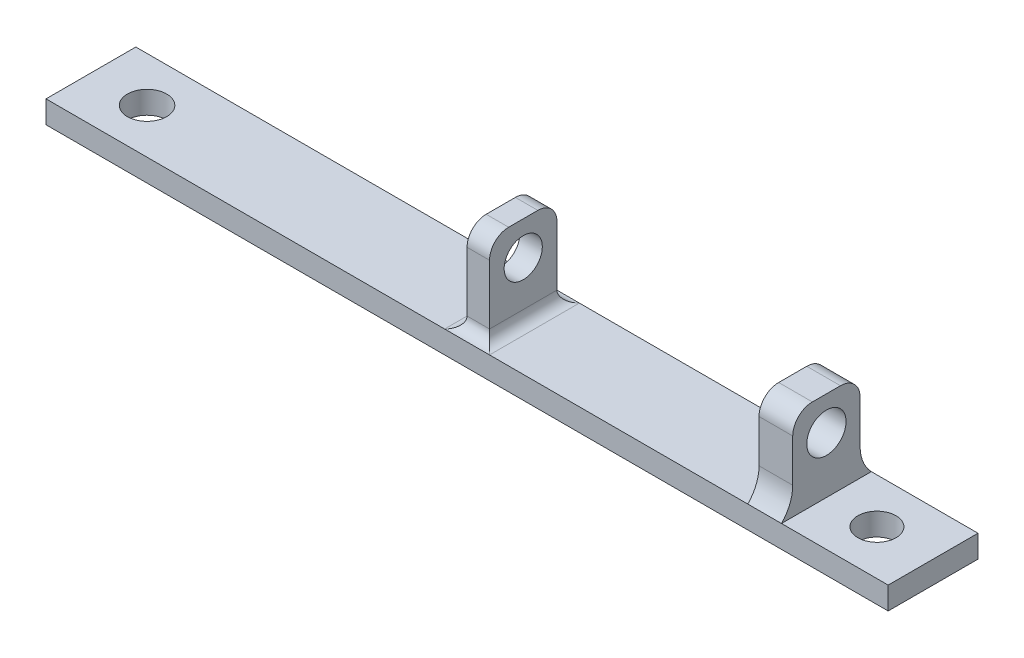
from build123d import *

# Parameters (mm, degrees)
SKETCH_1_W           = 75
SKETCH_1_H           = 8
SKETCH_1_R           = 1.75
SKETCH_1_R_2         = 1.7
EXTRUDE_1_DEPTH      = 2
EXTRUDE_2_DEPTH      = 1
EXTRUDE_2_DEPTH_BACK = 1
SKETCH_2_W           = 6
SKETCH_2_H           = 8
SKETCH_2_R           = 1.7
FILLET_2_R           = 1
FILLET_3_R           = 1.7
SKETCH_3_W           = 6
SKETCH_3_H           = 8
SKETCH_3_R           = 1.75
EXTRUDE_3_DEPTH      = 3
FILLET_6_R           = 1.75
FILLET_7_R           = 3.5


# Some blends are built 0.0001 mm under size
with BuildPart() as part:
    # 草图1 → 凸台-拉伸1 (new body)
    with BuildSketch(Plane(origin=(0, 0, 0), x_dir=(1, 0, 0), z_dir=(0, 1, 0))):
        Rectangle(SKETCH_1_W, SKETCH_1_H)
        with Locations(Location((-32.5, 0, 0), (0, 0, 270))):
            Circle(SKETCH_1_R, mode=Mode.SUBTRACT)
        with Locations(Location((32.5, 0, 0), (0, 0, 270))):
            Circle(SKETCH_1_R_2, mode=Mode.SUBTRACT)
    extrude(amount=EXTRUDE_1_DEPTH)

    # 草图2 → 凸台-拉伸2 (add, two sides: drawn at the far end of the back side and taken through both)
    with BuildSketch(Plane(origin=(0, 0, 0), x_dir=(0, 0, -1), z_dir=(1, 0, 0)).offset(-EXTRUDE_2_DEPTH_BACK)):
        with Locations((0, 6)):
            Rectangle(SKETCH_2_W, SKETCH_2_H)
        with Locations((0, 7)):
            Circle(SKETCH_2_R, mode=Mode.SUBTRACT)
    extrude(amount=EXTRUDE_2_DEPTH + EXTRUDE_2_DEPTH_BACK)

    # 圆角2
    fillet_2_edges = [part.edges().sort_by_distance(p)[0] for p in [
        (0, 2, -3),
        (-1, 2, 0),
        (0, 2, 3),
        (1, 2, 0),
    ]]
    fillet(fillet_2_edges, radius=FILLET_2_R - 0.0001)  # a hair under: the kernel refuses the full size

    # 圆角3
    fillet_3_edges = [part.edges().sort_by_distance(p)[0] for p in [
        (0, 10, -3),
        (0, 10, 3),
    ]]
    fillet(fillet_3_edges, radius=FILLET_3_R)

    # 草图3 → 凸台-拉伸3 (add)
    with BuildSketch(Plane(origin=(28, 0, 0), x_dir=(0, 0, -1), z_dir=(1, 0, 0))):
        with Locations((0, 6)):
            Rectangle(SKETCH_3_W, SKETCH_3_H)
        with Locations((0, 7)):
            Circle(SKETCH_3_R, mode=Mode.SUBTRACT)
    extrude(amount=-EXTRUDE_3_DEPTH)

    # 圆角6
    fillet_6_edges = [part.edges().sort_by_distance(p)[0] for p in [
        (26.5, 10, -3),
        (26.5, 10, 3),
    ]]
    fillet(fillet_6_edges, radius=FILLET_6_R)

    # 圆角7
    # the kernel refuses this fillet: 3.5 mm, written as the material it adds along each edge
    with BuildSketch(Plane(origin=(28, 2, -3), x_dir=(0, 0, -1), z_dir=(-1, 0, 0))) as fillet_7_piece_1:
        with BuildLine():
            CenterArc((3.5, -2.449489743), FILLET_7_R, 135.584691403, 44.415308597)
            Line((0, -2.449489743), (-0.07, -2.449489743))
            Line((-0.07, -2.449489743), (-0.07, 0))
            Line((-0.07, 0), (0, 0.07))
            ThreePointArc((0, 0.07), (0.5, 0.07), (0.95, 0.048989795))
            Line((0.95, 0.048989795), (1, 0))
        make_face()
    extrude(amount=3)
    with BuildSketch(Plane(origin=(28, 2, 3), x_dir=(0, 1, 0), z_dir=(-1, 0, 0))) as fillet_7_piece_2:
        with BuildLine():
            CenterArc((2.449489743, -3.5), FILLET_7_R, 90, 44.415308597)
            Line((0, -1), (-0.048989795, -0.95))
            ThreePointArc((-0.048989795, -0.95), (-0.07, -0.5), (-0.07, 0))
            Line((-0.07, 0), (0, 0.07))
            Line((0, 0.07), (2.449489743, 0.07))
            Line((2.449489743, 0.07), (2.449489743, 0))
        make_face()
    extrude(amount=3)


solid = part.part
